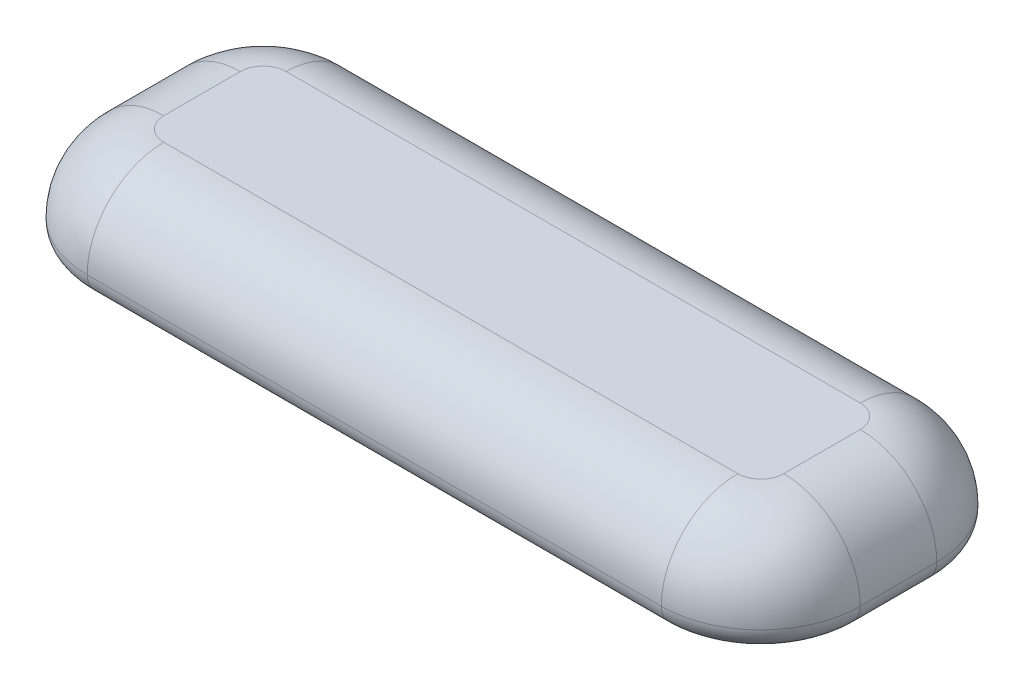
from build123d import *

# Parameters (mm, degrees)
EXTRUDE_1_DEPTH  = 10
SHELL_2_T        = 3
FILLET_3_R       = 10
FILLET_4_R       = 3
SKETCH_2_R       = 2.725
EXTRUDE_2_DEPTH  = 8
FILLET_7_R       = 5
CHAMFER_1_SIZE   = 0.2
CHAMFER_2_SIZE   = 0.2
FILLET_9_SIZE    = 2.5
FILLET_9_SIZE_2  = 4
FILLET_10_SIZE   = 2.5
FILLET_10_SIZE_2 = 4


# Some blends are built 0.0001 mm under size
with BuildPart() as part:
    # 草图1 → 凸台-拉伸1 (new body)
    with BuildSketch(Plane(origin=(0, 0, 0), x_dir=(1, 0, 0), z_dir=(0, 1, 0))):
        with BuildLine():
            Line((-37.5, 15), (37.5, 15))
            ThreePointArc((37.5, 15), (44.571067812, 12.071067812), (47.5, 5))
            Line((47.5, 5), (47.5, -5))
            ThreePointArc((47.5, -5), (44.571067812, -12.071067812), (37.5, -15))
            Line((37.5, -15), (-37.5, -15))
            ThreePointArc((-37.5, -15), (-44.571067812, -12.071067812), (-47.5, -5))
            Line((-47.5, -5), (-47.5, 5))
            ThreePointArc((-47.5, 5), (-44.571067812, 12.071067812), (-37.5, 15))
        make_face()
    extrude(amount=EXTRUDE_1_DEPTH)

    # 抽壳2
    shell_2_openings = [part.faces().sort_by_distance(p)[0] for p in [
        (0, 0, 0),
    ]]
    offset(amount=SHELL_2_T, openings=shell_2_openings, kind=Kind.INTERSECTION)

    # 圆角3
    # the kernel refuses this fillet: 10 mm, written as the material it takes off along each edge
    with BuildSketch(Plane(origin=(37.5, 13, 5), x_dir=(1, 0, 0), z_dir=(0, 0, -1))) as fillet_3_piece_1:
        with BuildLine():
            CenterArc((13 - FILLET_3_R, FILLET_3_R), FILLET_3_R, 270, 90)
            Line((13 - FILLET_3_R, 0), (13, 0))
            Line((13, 0), (13, FILLET_3_R))
        make_face()
    revolve(axis=Axis((37.5, 13, 5), (0, -1, 0)), revolution_arc=90, mode=Mode.SUBTRACT)
    with BuildSketch(Plane(origin=(50.5, 13, 5), x_dir=(0, -1, 0), z_dir=(0, 0, -1)), Plane(origin=(-50.5, 13, -5), x_dir=(0, -1, 0), z_dir=(0, 0, 1))) as fillet_3_piece_2:
        with BuildLine():
            CenterArc((FILLET_3_R, FILLET_3_R), FILLET_3_R, 180, 90)
            Line((0, FILLET_3_R), (0, 0))
            Line((0, 0), (FILLET_3_R, 0))
        make_face()
    extrude(amount=10, mode=Mode.SUBTRACT)
    with BuildSketch(Plane(origin=(37.5, 13, -5), x_dir=(0, 0, -1), z_dir=(-1, 0, 0))) as fillet_3_piece_3:
        with BuildLine():
            CenterArc((13 - FILLET_3_R, FILLET_3_R), FILLET_3_R, 270, 90)
            Line((13 - FILLET_3_R, 0), (13, 0))
            Line((13, 0), (13, FILLET_3_R))
        make_face()
    revolve(axis=Axis((37.5, 13, -5), (0, -1, 0)), revolution_arc=90, mode=Mode.SUBTRACT)
    with BuildSketch(Plane(origin=(37.5, 13, -18), x_dir=(0, -1, 0), z_dir=(-1, 0, 0)), Plane(origin=(-37.5, 13, 18), x_dir=(0, -1, 0), z_dir=(1, 0, 0))) as fillet_3_piece_4:
        with BuildLine():
            CenterArc((FILLET_3_R, FILLET_3_R), FILLET_3_R, 180, 90)
            Line((0, FILLET_3_R), (0, 0))
            Line((0, 0), (FILLET_3_R, 0))
        make_face()
    extrude(amount=75, mode=Mode.SUBTRACT)
    with BuildSketch(Plane(origin=(-37.5, 13, -5), x_dir=(-1, 0, 0), z_dir=(0, 0, 1))) as fillet_3_piece_5:
        with BuildLine():
            CenterArc((13 - FILLET_3_R, FILLET_3_R), FILLET_3_R, 270, 90)
            Line((13 - FILLET_3_R, 0), (13, 0))
            Line((13, 0), (13, FILLET_3_R))
        make_face()
    revolve(axis=Axis((-37.5, 13, -5), (0, -1, 0)), revolution_arc=90, mode=Mode.SUBTRACT)
    with BuildSketch(Plane(origin=(-37.5, 13, 5), x_dir=(0, 0, 1), z_dir=(1, 0, 0))) as fillet_3_piece_6:
        with BuildLine():
            CenterArc((13 - FILLET_3_R, FILLET_3_R), FILLET_3_R, 270, 90)
            Line((13 - FILLET_3_R, 0), (13, 0))
            Line((13, 0), (13, FILLET_3_R))
        make_face()
    revolve(axis=Axis((-37.5, 13, 5), (0, -1, 0)), revolution_arc=90, mode=Mode.SUBTRACT)

    # 圆角4
    fillet_4_edges = [part.edges().sort_by_distance(p)[0] for p in [
        (50.5, 0, 0),
        (46.692388155, 0, 14.192388155),
        (0, 0, 18),
        (-46.692388155, 0, 14.192388155),
        (-50.5, 0, 0),
        (-46.692388155, 0, -14.192388155),
        (0, 0, -18),
        (46.692388155, 0, -14.192388155),
    ]]
    fillet(fillet_4_edges, radius=FILLET_4_R - 0.0001)  # a hair under: the kernel refuses the full size

    # 草图2 → 凸台-拉伸2 (add)
    # profile 1 of 2: a face of its own
    with BuildSketch(Plane(origin=(0, 10, 0), x_dir=(-1, 0, 0), z_dir=(0, -1, 0))):
        with Locations(Location((37, 0, 0), (0, 0, 270))):
            Circle(SKETCH_2_R)
        Polygon((34.95, -0.55), (34.95, 0.55), (36.45, 0.55), (36.45, 2.05), (37.55, 2.05), (37.55, 0.55), (39.05, 0.55), (39.05, -0.55), (37.55, -0.55), (37.55, -2.05), (36.45, -2.05), (36.45, -0.55), align=None, mode=Mode.SUBTRACT)
    # profile 2 of 2: a face of its own
    with BuildSketch(Plane(origin=(0, 10, 0), x_dir=(-1, 0, 0), z_dir=(0, -1, 0))):
        with Locations(Location((-37, 0, 0), (0, 0, 90))):
            Circle(SKETCH_2_R)
        Polygon((-37.55, 0.55), (-37.55, 2.05), (-36.45, 2.05), (-36.45, 0.55), (-34.95, 0.55), (-34.95, -0.55), (-36.45, -0.55), (-36.45, -2.05), (-37.55, -2.05), (-37.55, -0.55), (-39.05, -0.55), (-39.05, 0.55), align=None, mode=Mode.SUBTRACT)
    extrude(amount=EXTRUDE_2_DEPTH)

    # 圆角7
    fillet_7_edges = [part.edges().sort_by_distance(p)[0] for p in [
        (-44.571067812, 10, 12.071067812),
        (0, 10, 15),
        (44.571067812, 10, 12.071067812),
        (47.5, 10, 0),
        (44.571067812, 10, -12.071067812),
        (0, 10, -15),
        (-44.571067812, 10, -12.071067812),
        (-47.5, 10, 0),
    ]]
    fillet(fillet_7_edges, radius=FILLET_7_R)

    # 倒角1
    chamfer_1_edges = [part.edges().sort_by_distance(p)[0] for p in [
        (35.7, 2, -0.55),
        (37.55, 2, 1.3),
        (39.05, 2, 0),
        (38.3, 2, -0.55),
        (37.55, 2, -1.3),
        (37, 2, -2.05),
        (34.95, 2, 0),
        (35.7, 2, 0.55),
        (36.45, 2, 1.3),
        (37, 2, 2.05),
        (38.3, 2, 0.55),
        (36.45, 2, -1.3),
    ]]
    chamfer(chamfer_1_edges, length=CHAMFER_1_SIZE)

    # 倒角2
    chamfer_2_edges = [part.edges().sort_by_distance(p)[0] for p in [
        (-37, 2, -2.05),
        (-37.55, 2, -1.3),
        (-38.3, 2, -0.55),
        (-39.05, 2, 0),
        (-37.55, 2, 1.3),
        (-35.7, 2, -0.55),
        (-38.3, 2, 0.55),
        (-37, 2, 2.05),
        (-36.45, 2, 1.3),
        (-35.7, 2, 0.55),
        (-34.95, 2, 0),
        (-36.45, 2, -1.3),
    ]]
    chamfer(chamfer_2_edges, length=CHAMFER_2_SIZE)

    # 圆角9
    # an asymmetric fillet: 4, 2.5 mm, written as the material it adds along each edge
    with BuildSketch(Plane(origin=(37, 10, 0), x_dir=(0, 0, -1), z_dir=(-1, 0, 0))) as fillet_9_piece_1:
        with BuildLine():
            Bezier((2.725 + FILLET_9_SIZE, 0), (2.725, 0), (2.725, FILLET_9_SIZE_2), weights=[1, 0.707106781, 1])
            Line((2.725, FILLET_9_SIZE_2), (2.725, 0))
            Line((2.725, 0), (2.725 + FILLET_9_SIZE, 0))
        make_face()
    revolve(axis=Axis((37, 10, 0), (0, -1, 0)))

    # 圆角10
    # an asymmetric fillet: 4, 2.5 mm, written as the material it adds along each edge
    with BuildSketch(Plane(origin=(-37, 10, 0), x_dir=(0, 0, 1), z_dir=(1, 0, 0))) as fillet_10_piece_1:
        with BuildLine():
            Bezier((2.725 + FILLET_10_SIZE, 0), (2.725, 0), (2.725, FILLET_10_SIZE_2), weights=[1, 0.707106781, 1])
            Line((2.725, FILLET_10_SIZE_2), (2.725, 0))
            Line((2.725, 0), (2.725 + FILLET_10_SIZE, 0))
        make_face()
    revolve(axis=Axis((-37, 10, 0), (0, -1, 0)))


solid = part.part
